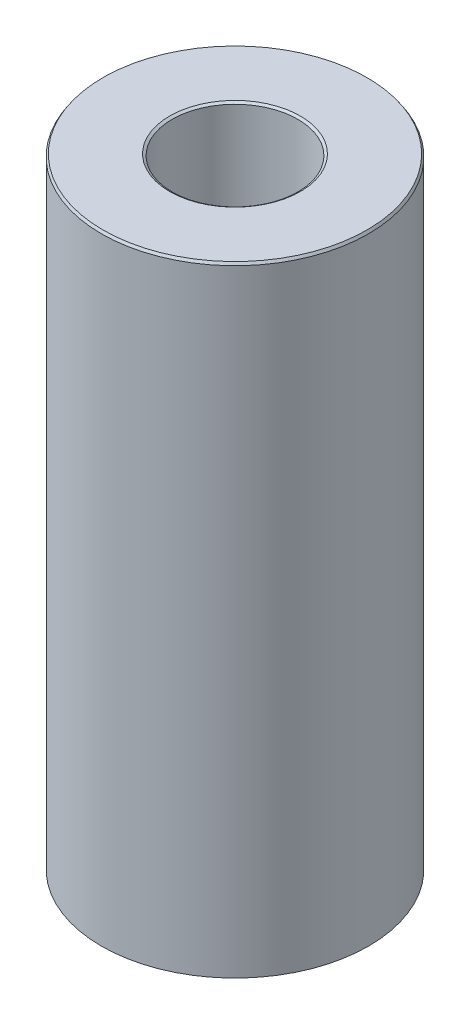
from build123d import *
from OCP.BRepFilletAPI import BRepFilletAPI_MakeChamfer

# Parameters (mm, degrees)
SKETCH1_R           = 27.5
BOSS_EXTRUDE1_DEPTH = 127.838153496
SKETCH2_R           = 12.949928326
CUT_EXTRUDE1_DEPTH  = 134.622952704
CHAMFER1_SIZE       = 0.512594582
CHAMFER1_SIZE2      = 0.324759627


with BuildPart() as part:
    # Sketch1 → Boss-Extrude1 (new body)
    with BuildSketch(Plane(origin=(0, 0, 0), x_dir=(1, 0, 0), z_dir=(0, 1, 0))):
        Circle(SKETCH1_R)
    extrude(amount=BOSS_EXTRUDE1_DEPTH)

    # Sketch2 → Cut-Extrude1 (cut, through all)
    with BuildSketch(Plane(origin=(0, 0, 0), x_dir=(1, 0, 0), z_dir=(0, 1, 0))):
        Circle(SKETCH2_R)
    extrude(amount=CUT_EXTRUDE1_DEPTH, mode=Mode.SUBTRACT)

    # Chamfer1: one chamfer whose edges measure the first distance from different faces: ONE call of the kernel's chamfer builder (chamfer() names one face for all edges)
    chamfer1_edges_1 = [part.edges().sort_by_distance(p)[0] for p in [
        (-12.949928326, 127.838153496, 0),
    ]]
    chamfer1_side_1 = [part.faces().sort_by_distance(p)[0] for p in [
        (-26.722182541, 127.838153496, 0),
    ]]
    chamfer1_edges_2 = [part.edges().sort_by_distance(p)[0] for p in [
        (-12.949928326, 0, 0),
    ]]
    chamfer1_side_2 = [part.faces().sort_by_distance(p)[0] for p in [
        (-12.949928326, 63.919076748, 0),
    ]]
    chamfer1_edges_3 = [part.edges().sort_by_distance(p)[0] for p in [
        (-27.5, 0, 0),
    ]]
    chamfer1_side_3 = [part.faces().sort_by_distance(p)[0] for p in [
        (-26.722182541, 0, 0),
    ]]
    chamfer1_edges_4 = [part.edges().sort_by_distance(p)[0] for p in [
        (-27.5, 127.838153496, 0),
    ]]
    chamfer1_side_4 = [part.faces().sort_by_distance(p)[0] for p in [
        (-27.5, 63.919076748, 0),
    ]]
    chamfer1 = BRepFilletAPI_MakeChamfer(part.part.solid().wrapped)
    for e in chamfer1_edges_1:
        chamfer1.Add(CHAMFER1_SIZE, CHAMFER1_SIZE2, e.wrapped, chamfer1_side_1[0].wrapped)  # the first distance lies on this face
    for e in chamfer1_edges_2:
        chamfer1.Add(CHAMFER1_SIZE, CHAMFER1_SIZE2, e.wrapped, chamfer1_side_2[0].wrapped)  # the first distance lies on this face
    for e in chamfer1_edges_3:
        chamfer1.Add(CHAMFER1_SIZE, CHAMFER1_SIZE2, e.wrapped, chamfer1_side_3[0].wrapped)  # the first distance lies on this face
    for e in chamfer1_edges_4:
        chamfer1.Add(CHAMFER1_SIZE, CHAMFER1_SIZE2, e.wrapped, chamfer1_side_4[0].wrapped)  # the first distance lies on this face
    add(Compound.cast(chamfer1.Shape()), mode=Mode.REPLACE)


solid = part.part
